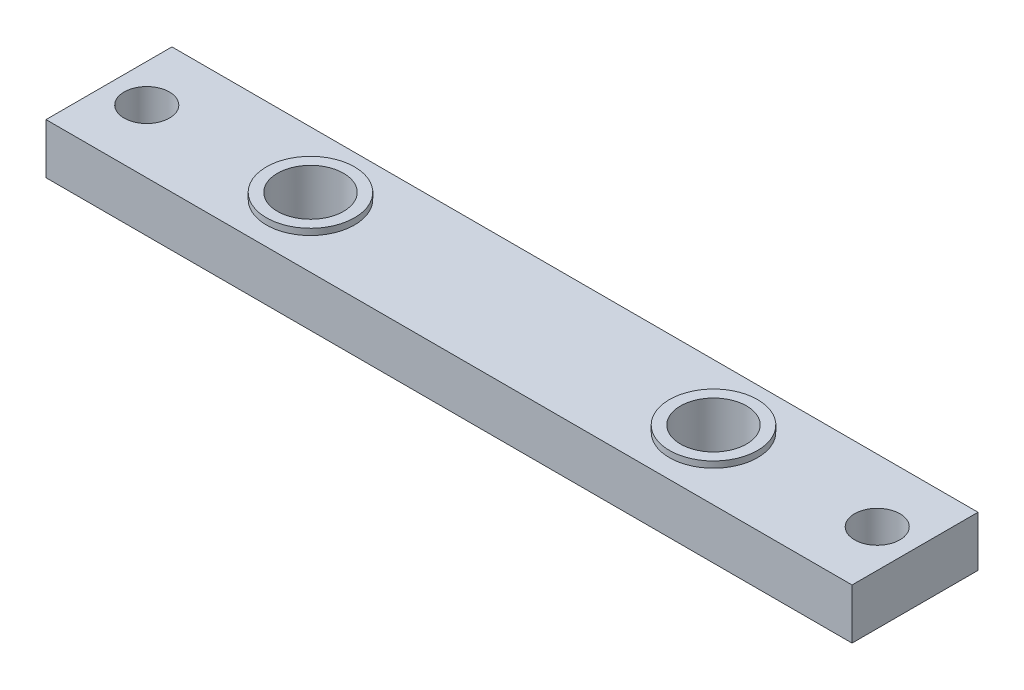
from build123d import *

# Parameters (mm, degrees)
SKETCH1_W                 = 64
SKETCH1_H                 = 10
SKETCH1_R                 = 1.8
SKETCH1_R_2               = 2.625
BOSS_EXTRUDE1_DEPTH       = 4
BOSS_EXTRUDE2_START       = 4
BOSS_EXTRUDE2_OUTLINE_R   = 3.5
BOSS_EXTRUDE2_OUTLINE_R_2 = 2.625
BOSS_EXTRUDE2_DEPTH       = 0.5


# Read off the part's stored shape, not the designer's step: Boss-Extrude2
with BuildPart() as part:
    # Sketch1 → Boss-Extrude1 (new body)
    with BuildSketch(Plane(origin=(0, 0, 0), x_dir=(1, 0, 0), z_dir=(0, 1, 0))):
        with Locations((32, 5)):
            Rectangle(SKETCH1_W, SKETCH1_H)
        with Locations(Location((3, 5, 0), (0, 0, 270))):
            Circle(SKETCH1_R, mode=Mode.SUBTRACT)
        with Locations(Location((16, 5, 0), (0, 0, 270))):
            Circle(SKETCH1_R_2, mode=Mode.SUBTRACT)
        with Locations(Location((61, 5, 0), (0, 0, 90))):
            Circle(SKETCH1_R, mode=Mode.SUBTRACT)
        with Locations(Location((48, 5, 0), (0, 0, 90))):
            Circle(SKETCH1_R_2, mode=Mode.SUBTRACT)
    extrude(amount=BOSS_EXTRUDE1_DEPTH)

    # Boss-Extrude2 outline → Boss-Extrude2 (add)
    # profile 1 of 2: a face of its own
    with BuildSketch(Plane(origin=(0, 0, 0), x_dir=(1, 0, 0), z_dir=(0, 1, 0)).offset(BOSS_EXTRUDE2_START)):
        with Locations((16, 5)):
            Circle(BOSS_EXTRUDE2_OUTLINE_R)
        with Locations((16, 5)):
            Circle(BOSS_EXTRUDE2_OUTLINE_R_2, mode=Mode.SUBTRACT)
    # profile 2 of 2: a face of its own
    with BuildSketch(Plane(origin=(0, 0, 0), x_dir=(1, 0, 0), z_dir=(0, 1, 0)).offset(BOSS_EXTRUDE2_START)):
        with Locations((48, 5)):
            Circle(BOSS_EXTRUDE2_OUTLINE_R)
        with Locations((48, 5)):
            Circle(BOSS_EXTRUDE2_OUTLINE_R_2, mode=Mode.SUBTRACT)
    extrude(amount=BOSS_EXTRUDE2_DEPTH)


solid = part.part
